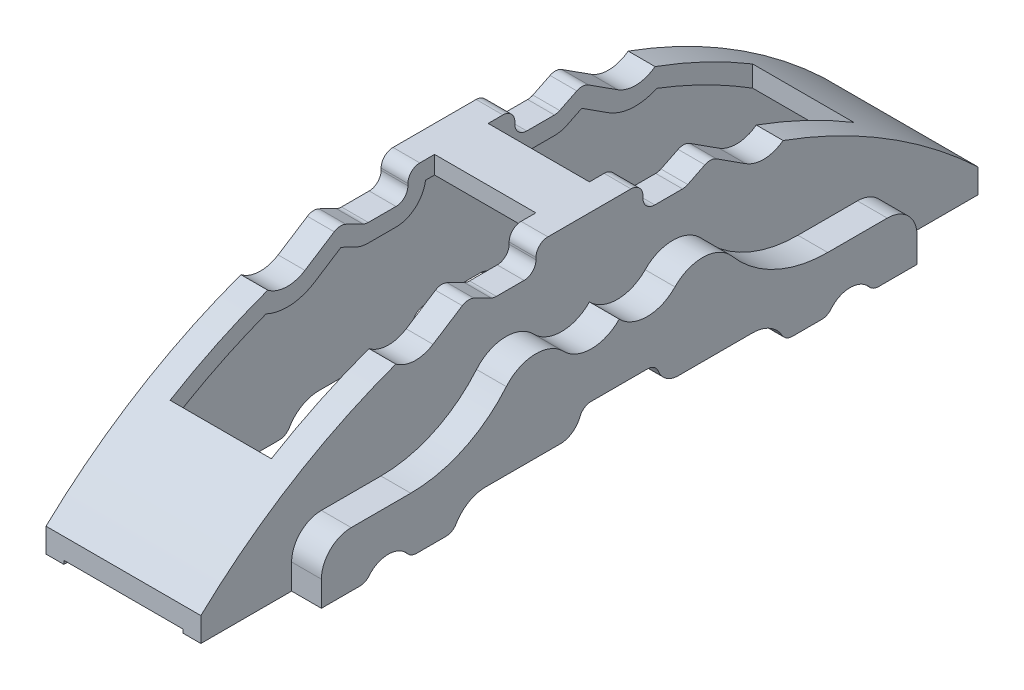
from build123d import *

# Parameters (mm, degrees)
BOSS_EXTRUDE1_DEPTH     = 26
SHELL1_T                = -3
FILLET1_R               = 8
CUT_EXTRUDE2_DEPTH      = 119.136833237
CUT_EXTRUDE2_DEPTH_BACK = 119.136833237
SKETCH2_W               = 17
SKETCH2_H               = 44.4
BOSS_EXTRUDE2_DEPTH     = 5
SCALE1_SCALE            = 2


with BuildPart() as part:
    # Sketch1 → Boss-Extrude1 (new body)
    with BuildSketch(Plane(origin=(0, 0, 0), x_dir=(0, 0, -1), z_dir=(1, 0, 0))):
        with BuildLine():
            ThreePointArc((4.724842523, 72.434451413), (5.857564928, 72.082765689), (6.591925034, 71.151391365))
            ThreePointArc((6.591925034, 71.151391365), (7.906160781, 69.484572294), (9.933319206, 68.855183597))
            Line((9.933319206, 68.855183597), (22.404664256, 68.855183597))
            ThreePointArc((22.404664256, 68.855183597), (25.266253288, 68.089589608), (27.363257321, 65.997365902))
            ThreePointArc((27.363257321, 65.997365902), (28.095102576, 65.267188961), (29.093784659, 65))
            Line((29.093784659, 65), (34.007125894, 65))
            ThreePointArc((34.007125894, 65), (34.860764557, 65.191326167), (35.551079806, 65.728698967))
            ThreePointArc((35.551079806, 65.728698967), (38.773240635, 67.249460207), (41.995401464, 65.728698967))
            ThreePointArc((41.995401464, 65.728698967), (42.685716713, 65.191326167), (43.539355376, 65))
            Line((43.539355376, 65), (58.23274766, 65))
            ThreePointArc((58.23274766, 65), (0, 87.27), (-58.23274766, 65))
            Line((-58.23274766, 65), (-43.539355376, 65))
            ThreePointArc((-43.539355376, 65), (-42.685716713, 65.191326167), (-41.995401464, 65.728698967))
            ThreePointArc((-41.995401464, 65.728698967), (-38.773240635, 67.249460207), (-35.551079806, 65.728698967))
            ThreePointArc((-35.551079806, 65.728698967), (-34.860764557, 65.191326167), (-34.007125894, 65))
            Line((-34.007125894, 65), (-29.093784659, 65))
            ThreePointArc((-29.093784659, 65), (-28.095102576, 65.267188961), (-27.363257321, 65.997365902))
            ThreePointArc((-27.363257321, 65.997365902), (-25.266253288, 68.089589608), (-22.404664256, 68.855183597))
            Line((-22.404664256, 68.855183597), (-9.933319206, 68.855183597))
            ThreePointArc((-9.933319206, 68.855183597), (-7.906160781, 69.484572294), (-6.591925034, 71.151391365))
            ThreePointArc((-6.591925034, 71.151391365), (-5.857564928, 72.082765689), (-4.724842523, 72.434451413))
            Line((-4.724842523, 72.434451413), (4.724842523, 72.434451413))
        make_face()
        with BuildLine():
            ThreePointArc((-26.260597796, 89.017696059), (-29.423456798, 88.156670573), (-32.508441747, 89.264781494))
            ThreePointArc((-32.508441747, 89.264781494), (-49.903543995, 80.83709728), (-65.23274766, 69.062932408))
            Line((-65.23274766, 69.062932408), (-65.23274766, 65))
            Line((-65.23274766, 65), (-58.23274766, 65))
            ThreePointArc((-58.23274766, 65), (0, 87.27), (58.23274766, 65))
            Line((58.23274766, 65), (65.23274766, 65))
            Line((65.23274766, 65), (65.23274766, 69.062932408))
            ThreePointArc((65.23274766, 69.062932408), (49.903543995, 80.83709728), (32.508441747, 89.264781494))
            ThreePointArc((32.508441747, 89.264781494), (29.423456798, 88.156670573), (26.260597796, 89.017696059))
            Line((26.260597796, 89.017696059), (21.348317759, 92.17397823))
            ThreePointArc((21.348317759, 92.17397823), (20.381750503, 92.488086609), (19.385601255, 92.286584724))
            Line((19.385601255, 92.286584724), (16.506758015, 90.872845424))
            ThreePointArc((16.506758015, 90.872845424), (16.077698159, 90.719928959), (15.625165932, 90.668060008))
            Line((15.625165932, 90.668060008), (10.976097383, 90.668060008))
            ThreePointArc((10.976097383, 90.668060008), (9.561883821, 91.253846445), (8.976097383, 92.668060008))
            Line((8.976097383, 92.668060008), (8.976097383, 93))
            ThreePointArc((8.976097383, 93), (8.390310946, 94.414213562), (6.976097383, 95))
            Line((6.976097383, 95), (-6.976097383, 95))
            ThreePointArc((-6.976097383, 95), (-8.390310946, 94.414213562), (-8.976097383, 93))
            Line((-8.976097383, 93), (-8.976097383, 92.668060008))
            ThreePointArc((-8.976097383, 92.668060008), (-9.561883821, 91.253846445), (-10.976097383, 90.668060008))
            Line((-10.976097383, 90.668060008), (-15.625165932, 90.668060008))
            ThreePointArc((-15.625165932, 90.668060008), (-16.077698159, 90.719928959), (-16.506758015, 90.872845424))
            Line((-16.506758015, 90.872845424), (-19.385601255, 92.286584724))
            ThreePointArc((-19.385601255, 92.286584724), (-20.381750503, 92.488086609), (-21.348317759, 92.17397823))
            Line((-21.348317759, 92.17397823), (-26.260597796, 89.017696059))
        make_face()
    extrude(amount=BOSS_EXTRUDE1_DEPTH)

    # Shell1
    shell1_openings = [part.faces().sort_by_distance(p)[0] for p in [
        (13, 72.434451413, 0),
        (13, 72.082765689, 5.857564928),
        (13, 69.484572294, 7.906160781),
        (13, 68.855183597, 16.168991731),
        (13, 68.089589608, 25.266253288),
        (13, 65.267188961, 28.095102576),
        (13, 65, 31.550455276),
        (13, 65.191326167, 34.860764557),
        (13, 67.249460207, 38.773240635),
        (13, 65.191326167, 42.685716713),
        (13, 65, 54.386051518),
        (13, 65, -54.386051518),
        (13, 65.191326167, -42.685716713),
        (13, 67.249460207, -38.773240635),
        (13, 65.191326167, -34.860764557),
        (13, 65, -31.550455276),
        (13, 65.267188961, -28.095102576),
        (13, 68.089589608, -25.266253288),
        (13, 68.855183597, -16.168991731),
        (13, 69.484572294, -7.906160781),
        (13, 72.082765689, -5.857564928),
    ]]
    offset(amount=SHELL1_T, openings=shell1_openings, kind=Kind.INTERSECTION)

    # Fillet1
    # the kernel refuses this fillet: 8 mm, written as the material it takes off along each edge
    with BuildSketch(Plane(origin=(23, 65, 62.23274766), x_dir=(0, 0, 1), z_dir=(-1, 0, 0)), Plane(origin=(3, 65, -62.23274766), x_dir=(0, 0, -1), z_dir=(1, 0, 0))) as fillet1_piece_1:
        with BuildLine():
            CenterArc((6.042903454, 8), FILLET1_R, 220.942907945, 49.057092055)
            Line((0, 2.757546581), (0, 0))
            Line((0, 0), (6.042903454, 0))
        make_face()
    extrude(amount=20, mode=Mode.SUBTRACT)

    # Sketch2 → Cut-Extrude2 (cut, two sides: drawn at the far end of the back side and taken through both)
    with BuildSketch(Plane(origin=(0, 0, 0), x_dir=(1, 0, 0), z_dir=(0, 1, 0)).offset(-CUT_EXTRUDE2_DEPTH_BACK)):
        with Locations((13, 26.7)):
            Rectangle(SKETCH2_W, SKETCH2_H)
        with Locations((13, -26.7)):
            Rectangle(SKETCH2_W, SKETCH2_H)
    extrude(amount=CUT_EXTRUDE2_DEPTH + CUT_EXTRUDE2_DEPTH_BACK, mode=Mode.SUBTRACT)

    # Sketch3 → Boss-Extrude2 (add)
    with BuildSketch(Plane(origin=(26, 0, 0), x_dir=(0, 0, -1), z_dir=(1, 0, 0))):
        with BuildLine():
            Line((-50, 65), (-50, 69.239745152))
            ThreePointArc((-50, 69.239745152), (-48.535533906, 72.775279058), (-45, 74.239745152))
            Line((-45, 74.239745152), (-35, 74.239745152))
            ThreePointArc((-35, 74.239745152), (-26.149852734, 76.198914373), (-18.953477781, 81.710324193))
            ThreePointArc((-18.953477781, 81.710324193), (-14.231643117, 84.010777372), (-9.359411224, 82.048848778))
            ThreePointArc((-9.359411224, 82.048848778), (-4.679705612, 80.067841268), (0, 82.048848778))
            ThreePointArc((0, 82.048848778), (4.679705612, 80.067841268), (9.359411224, 82.048848778))
            ThreePointArc((9.359411224, 82.048848778), (14.231643117, 84.010777372), (18.953477781, 81.710324193))
            ThreePointArc((18.953477781, 81.710324193), (26.149852734, 76.198914373), (35, 74.239745152))
            Line((35, 74.239745152), (45, 74.239745152))
            ThreePointArc((45, 74.239745152), (48.535533906, 72.775279058), (50, 69.239745152))
            Line((50, 69.239745152), (50, 65))
            Line((50, 65), (43.539355376, 65))
            ThreePointArc((43.539355376, 65), (42.685716713, 65.191326167), (41.995401464, 65.728698967))
            ThreePointArc((41.995401464, 65.728698967), (38.773240635, 67.249460207), (35.551079806, 65.728698967))
            ThreePointArc((35.551079806, 65.728698967), (34.860764557, 65.191326167), (34.007125894, 65))
            Line((34.007125894, 65), (29.093784659, 65))
            ThreePointArc((29.093784659, 65), (28.095102576, 65.267188961), (27.363257321, 65.997365902))
            ThreePointArc((27.363257321, 65.997365902), (25.266253288, 68.089589608), (22.404664256, 68.855183597))
            Line((22.404664256, 68.855183597), (9.933319206, 68.855183597))
            ThreePointArc((9.933319206, 68.855183597), (7.906160781, 69.484572294), (6.591925034, 71.151391365))
            ThreePointArc((6.591925034, 71.151391365), (5.857564928, 72.082765689), (4.724842523, 72.434451413))
            Line((4.724842523, 72.434451413), (-4.724842523, 72.434451413))
            ThreePointArc((-4.724842523, 72.434451413), (-5.857564928, 72.082765689), (-6.591925034, 71.151391365))
            ThreePointArc((-6.591925034, 71.151391365), (-7.906160781, 69.484572294), (-9.933319206, 68.855183597))
            Line((-9.933319206, 68.855183597), (-22.404664256, 68.855183597))
            ThreePointArc((-22.404664256, 68.855183597), (-25.266253288, 68.089589608), (-27.363257321, 65.997365902))
            ThreePointArc((-27.363257321, 65.997365902), (-28.095102576, 65.267188961), (-29.093784659, 65))
            Line((-29.093784659, 65), (-34.007125894, 65))
            ThreePointArc((-34.007125894, 65), (-34.860764557, 65.191326167), (-35.551079806, 65.728698967))
            ThreePointArc((-35.551079806, 65.728698967), (-38.773240635, 67.249460207), (-41.995401464, 65.728698967))
            ThreePointArc((-41.995401464, 65.728698967), (-42.685716713, 65.191326167), (-43.539355376, 65))
            Line((-43.539355376, 65), (-50, 65))
        make_face()
    extrude(amount=BOSS_EXTRUDE2_DEPTH)


with BuildPart() as part_1:
    # Scale1: scaled about (16.265798752, 77.126687756, 0)
    add(part.part.scale(SCALE1_SCALE).moved(Location((-16.265798752, -77.126687756, 0))))


solid = part_1.part
